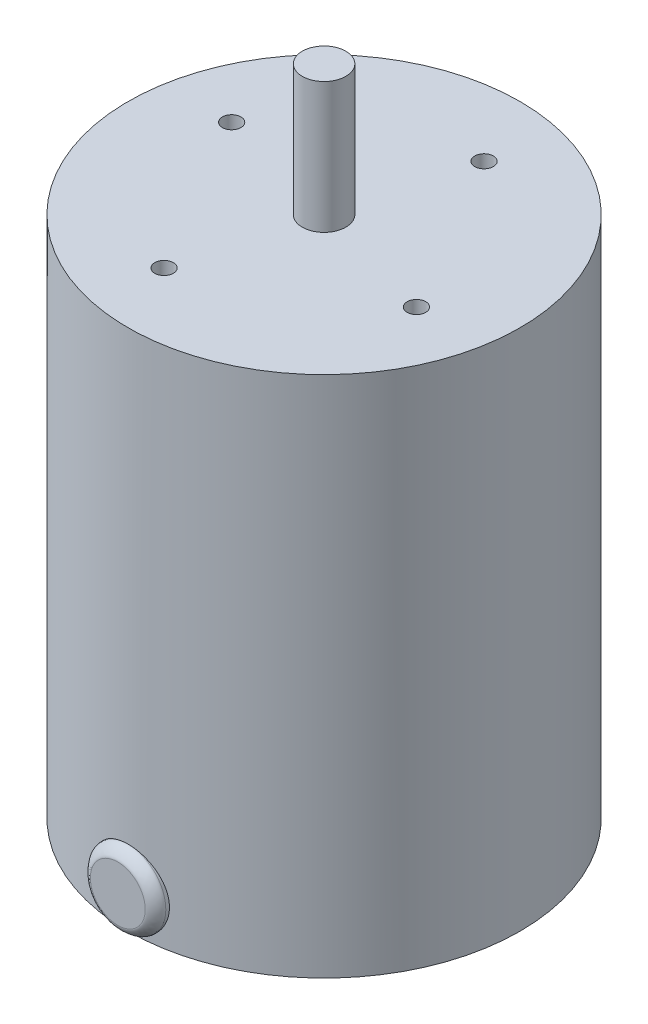
from build123d import *

# Parameters (mm, degrees)
SKETCH2_R           = 5.5
BOSS_EXTRUDE1_DEPTH = 1.5
CIRPATTERN1_COUNT   = 4
FILLET2_SIZE        = 1.5


with BuildPart() as part:
    # Sketch1 → Revolve1 (revolve)
    with BuildSketch(Plane.XY, mode=Mode.PRIVATE) as revolve1_sk:
        Polygon((0, 38.1), (0, -38.1), (28.575, -38.1), (28.575, 38.1), (3.175, 38.1), (3.175, 57.15), (0, 57.15), align=None)
    revolve(revolve1_sk.sketch.rotate(Axis((0, 0, 0), (0, 1, 0)), 90), axis=Axis((0, 0, 0), (0, 1, 0)))

    # Sketch2 → Boss-Extrude1 (add, symmetric)
    with BuildSketch(Plane.XY.offset(28.575)):
        with Locations(Location((0, -32.6, 0), (0, 0, 270))):
            Circle(SKETCH2_R)
    extrude(amount=BOSS_EXTRUDE1_DEPTH, both=True)

    # Sketch5 → #6-32 Tapped Hole1 (revolve, cut)
    with BuildSketch(Plane(origin=(4.930502809, 38.1, -18.400886991), x_dir=(0, 0, 1), z_dir=(1, 0, 0))):
        Polygon((0, 0), (0, 6.81269403), (1.35255, 6), (1.35255, 0), align=None)
    f_6_32_tapped_hole1 = revolve(axis=Axis((4.930502809, 44.45, -18.400886991), (0, -1, 0)), mode=Mode.SUBTRACT)

    # CirPattern1: #6-32 Tapped Hole1 ×4 about axis
    cirpattern1_axis = Axis((0, 0, 0), (0, 1, 0))
    for i in range(1, CIRPATTERN1_COUNT):
        add(f_6_32_tapped_hole1.rotate(cirpattern1_axis, i * 360 / CIRPATTERN1_COUNT), mode=Mode.SUBTRACT)

    # Fillet2
    # a fillet whose section is not a circle: 1.5 mm, written as the material it takes off along each edge
    with BuildSketch(Plane(origin=(0, -32.6, 30.075), x_dir=(0, -1, 0), z_dir=(-1, 0, 0))) as fillet2_piece_1_section:
        with BuildLine():
            Bezier((5.5, -FILLET2_SIZE), (5.5, 0), (5.5 - FILLET2_SIZE, 0), weights=[1, 0.333333333, 1])
            Line((5.5 - FILLET2_SIZE, 0), (5.5, 0))
            Line((5.5, 0), (5.5, -FILLET2_SIZE))
        make_face()
    fillet2_piece_1 = revolve(axis=Axis((0, -32.6, 30.075), (0, 0, 1)), mode=Mode.PRIVATE)
    fillet2_piece_1 = fillet2_piece_1 - Plane(origin=(0, -32.6, 0), x_dir=(0, 0, -1), z_dir=(0, 1, 0)) * Cylinder(28.575, 22, mode=Mode.PRIVATE)
    add(fillet2_piece_1, mode=Mode.SUBTRACT)


solid = part.part
